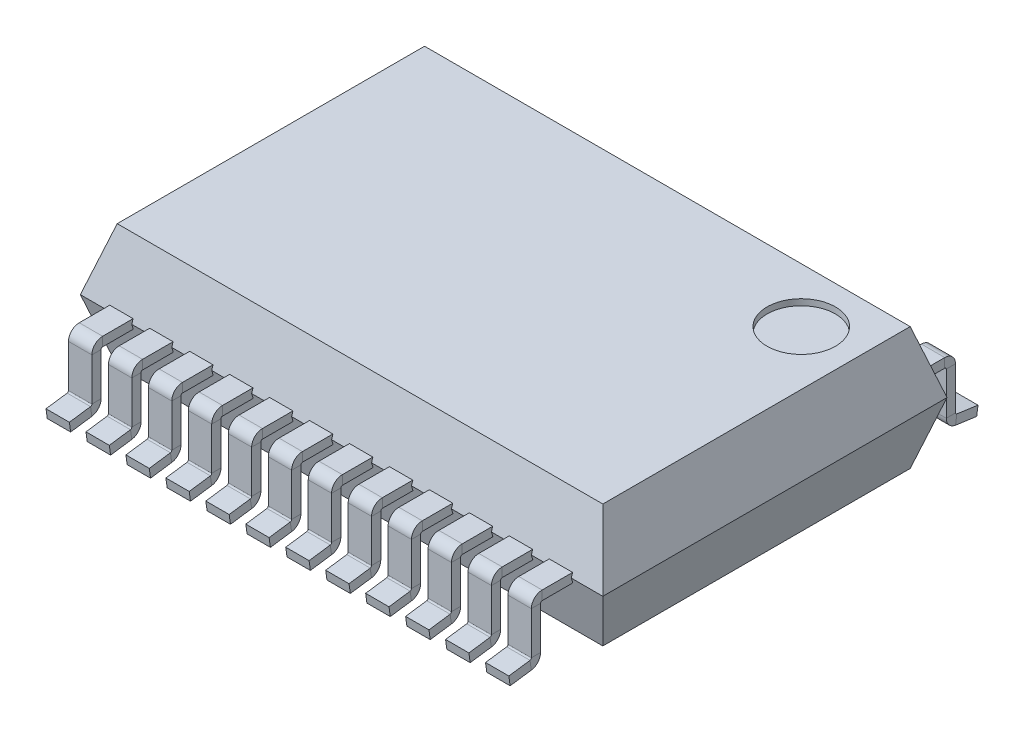
from build123d import *

# Parameters (mm, degrees)
BOSS_EXTRUDE1_DEPTH      = 1
BOSS_EXTRUDE1_DEPTH_BACK = 1
SKETCH1_W                = 8.5
SKETCH1_H                = 5.6
CHAMFER2_SIZE            = 0.3
CHAMFER2_SIZE2           = 1
CHAMFER5_SIZE            = 1
CHAMFER5_SIZE_2          = 0.3
BASE_FLANGE3_DEPTH       = 0.38
DERIVEDBEND140_START     = -3.7925
DERIVEDBEND140_DEPTH     = 0.38
DERIVEDBEND140_START_2   = -3.1425
DERIVEDBEND140_2_DEPTH   = 0.38
DERIVEDBEND140_START_3   = -2.4925
DERIVEDBEND140_3_DEPTH   = 0.38
DERIVEDBEND140_START_4   = -1.8425
DERIVEDBEND140_4_DEPTH   = 0.38
DERIVEDBEND140_START_5   = -1.1925
DERIVEDBEND140_5_DEPTH   = 0.38
DERIVEDBEND140_START_6   = 0.1075
DERIVEDBEND140_6_DEPTH   = 0.38
DERIVEDBEND140_START_7   = 0.7575
DERIVEDBEND140_7_DEPTH   = 0.38
DERIVEDBEND140_START_8   = 1.4075
DERIVEDBEND140_8_DEPTH   = 0.38
DERIVEDBEND140_START_9   = 2.0575
DERIVEDBEND140_9_DEPTH   = 0.38
DERIVEDBEND140_START_10  = 2.7075
DERIVEDBEND140_10_DEPTH  = 0.38
DERIVEDBEND140_START_11  = 3.3575
DERIVEDBEND140_11_DEPTH  = 0.38
SKETCH104_R              = 0.555763408
CUT_EXTRUDE2_DEPTH       = 0.1


# Read off the part's stored shape, not the designer's step: DerivedBend140
# Sheet-metal steps are written as plain solids
with BuildPart() as part:
    # Sketch1 → Boss-Extrude1 (new, two sides: drawn at the far end of the back side and taken through both)
    with BuildSketch(Plane(origin=(0, 0, 0), x_dir=(1, 0, 0), z_dir=(0, 1, 0)).offset(-BOSS_EXTRUDE1_DEPTH_BACK)):
        Rectangle(SKETCH1_W, SKETCH1_H)
    extrude(amount=BOSS_EXTRUDE1_DEPTH + BOSS_EXTRUDE1_DEPTH_BACK)

    # Chamfer2
    chamfer2_edges = [part.edges().sort_by_distance(p)[0] for p in [
        (-4.25, -1, 0),
        (0, -1, 2.8),
        (4.25, -1, 0),
        (0, -1, -2.8),
    ]]
    chamfer2_side = [part.faces().sort_by_distance(p)[0] for p in [
        (0, -1, 0),
    ]]
    chamfer(chamfer2_edges, length=CHAMFER2_SIZE, length2=CHAMFER2_SIZE2, reference=chamfer2_side[0])

    # Chamfer5
    # the kernel refuses this chamfer: 1, 0.3 mm, written as the material it takes off along each edge
    with BuildSketch(Plane(origin=(-6.845941668, 1, 2.8), x_dir=(0, -0.9999387354199845, 0.0110691195079924), z_dir=(1, 0, 0))) as chamfer5_piece_1:
        Polygon((CHAMFER5_SIZE * 0.99993873542, CHAMFER5_SIZE * 0.011069119508), (-CHAMFER5_SIZE_2 * 0.011069119508, CHAMFER5_SIZE_2 * 0.99993873542), (0, 0), align=None)
    extrude(amount=13.691883336, mode=Mode.SUBTRACT)
    with BuildSketch(Plane(origin=(-4.25, 1, -5.395941668), x_dir=(-0.0110691195079924, -0.9999387354199845, 0), z_dir=(0, 0, 1))) as chamfer5_piece_2:
        Polygon((CHAMFER5_SIZE * 0.99993873542, CHAMFER5_SIZE * 0.011069119508), (-CHAMFER5_SIZE_2 * 0.011069119508, CHAMFER5_SIZE_2 * 0.99993873542), (0, 0), align=None)
    extrude(amount=10.791883336, mode=Mode.SUBTRACT)
    with BuildSketch(Plane(origin=(6.845941668, 1, -2.8), x_dir=(0, 0.1220777947558593, 0.992520534814039), z_dir=(-1, 0, 0))) as chamfer5_piece_3:
        Polygon((CHAMFER5_SIZE_2 * 0.992520534814, -CHAMFER5_SIZE_2 * 0.122077794756), (-CHAMFER5_SIZE * 0.122077794756, -CHAMFER5_SIZE * 0.992520534814), (0, 0), align=None)
    extrude(amount=13.691883336, mode=Mode.SUBTRACT)
    with BuildSketch(Plane(origin=(4.25, 1, 5.395941668), x_dir=(-0.992520534814039, 0.1220777947558593, 0), z_dir=(0, 0, -1))) as chamfer5_piece_4:
        Polygon((CHAMFER5_SIZE_2 * 0.992520534814, -CHAMFER5_SIZE_2 * 0.122077794756), (-CHAMFER5_SIZE * 0.122077794756, -CHAMFER5_SIZE * 0.992520534814), (0, 0), align=None)
    extrude(amount=10.791883336, mode=Mode.SUBTRACT)

    # Sketch104 → Cut-Extrude2 (cut)
    with BuildSketch(Plane(origin=(0, 1, 0), x_dir=(1, 0, 0), z_dir=(0, 1, 0))):
        with Locations(Location((3.0642029, 1.6142029, 0), (0, 0, 270))):
            Circle(SKETCH104_R)
    extrude(amount=-CUT_EXTRUDE2_DEPTH, mode=Mode.SUBTRACT)


with BuildPart() as body_2:
    # Sketch6 → Base-Flange3 (new body)
    with BuildSketch(Plane(origin=(-0.1625, 0, 0), x_dir=(0, 0, -1), z_dir=(1, 0, 0))):
        with BuildLine():
            Line((-2.771, -0.08), (-3.275, -0.08))
            ThreePointArc((-3.275, -0.08), (-3.29267767, -0.08732233), (-3.3, -0.105))
            Line((-3.3, -0.105), (-3.3, -0.797874821))
            ThreePointArc((-3.3, -0.797874821), (-3.342925823, -0.912685151), (-3.450644707, -0.971171733))
            Line((-3.450644707, -0.971171733), (-3.795134034, -1.01958655))
            Line((-3.795134034, -1.01958655), (-3.81601, -0.87104634))
            Line((-3.81601, -0.87104634), (-3.471520672, -0.822631523))
            ThreePointArc((-3.471520672, -0.822631523), (-3.45613226, -0.814276297), (-3.45, -0.797874821))
            Line((-3.45, -0.797874821), (-3.45, -0.105))
            ThreePointArc((-3.45, -0.105), (-3.398743687, 0.018743687), (-3.275, 0.07))
            Line((-3.275, 0.07), (-2.771, 0.07))
            Line((-2.771, 0.07), (-2.771, -0.08))
        make_face()
    extrude(amount=-BASE_FLANGE3_DEPTH)


with BuildPart() as body_3:
    # DerivedBend140 outline → DerivedBend140 (new body)
    with BuildSketch(Plane.YZ.offset(DERIVEDBEND140_START)):
        with BuildLine():
            ThreePointArc((-0.797874821, 3.45), (-0.814276297, 3.45613226), (-0.822631523, 3.471520672))
            Line((-0.822631523, 3.471520672), (-0.87104634, 3.81601))
            Line((-0.87104634, 3.81601), (-1.01958655, 3.795134034))
            Line((-1.01958655, 3.795134034), (-0.971171733, 3.450644707))
            ThreePointArc((-0.971171733, 3.450644707), (-0.912685151, 3.342925823), (-0.797874821, 3.3))
            Line((-0.797874821, 3.3), (-0.105, 3.3))
            ThreePointArc((-0.105, 3.3), (-0.08732233, 3.29267767), (-0.08, 3.275))
            Line((-0.08, 3.275), (-0.08, 2.771))
            Line((-0.08, 2.771), (0.07, 2.771))
            Line((0.07, 2.771), (0.07, 3.275))
            ThreePointArc((0.07, 3.275), (0.018743687, 3.398743687), (-0.105, 3.45))
            Line((-0.105, 3.45), (-0.797874821, 3.45))
        make_face()
    extrude(amount=DERIVEDBEND140_DEPTH)


with BuildPart() as body_4:
    # DerivedBend140 2 outline → DerivedBend140 2 (new body)
    with BuildSketch(Plane.YZ.offset(DERIVEDBEND140_START_2)):
        with BuildLine():
            ThreePointArc((-0.797874821, 3.45), (-0.814276297, 3.45613226), (-0.822631523, 3.471520672))
            Line((-0.822631523, 3.471520672), (-0.87104634, 3.81601))
            Line((-0.87104634, 3.81601), (-1.01958655, 3.795134034))
            Line((-1.01958655, 3.795134034), (-0.971171733, 3.450644707))
            ThreePointArc((-0.971171733, 3.450644707), (-0.912685151, 3.342925823), (-0.797874821, 3.3))
            Line((-0.797874821, 3.3), (-0.105, 3.3))
            ThreePointArc((-0.105, 3.3), (-0.08732233, 3.29267767), (-0.08, 3.275))
            Line((-0.08, 3.275), (-0.08, 2.771))
            Line((-0.08, 2.771), (0.07, 2.771))
            Line((0.07, 2.771), (0.07, 3.275))
            ThreePointArc((0.07, 3.275), (0.018743687, 3.398743687), (-0.105, 3.45))
            Line((-0.105, 3.45), (-0.797874821, 3.45))
        make_face()
    extrude(amount=DERIVEDBEND140_2_DEPTH)


with BuildPart() as body_5:
    # DerivedBend140 3 outline → DerivedBend140 3 (new body)
    with BuildSketch(Plane.YZ.offset(DERIVEDBEND140_START_3)):
        with BuildLine():
            ThreePointArc((-0.797874821, 3.45), (-0.814276297, 3.45613226), (-0.822631523, 3.471520672))
            Line((-0.822631523, 3.471520672), (-0.87104634, 3.81601))
            Line((-0.87104634, 3.81601), (-1.01958655, 3.795134034))
            Line((-1.01958655, 3.795134034), (-0.971171733, 3.450644707))
            ThreePointArc((-0.971171733, 3.450644707), (-0.912685151, 3.342925823), (-0.797874821, 3.3))
            Line((-0.797874821, 3.3), (-0.105, 3.3))
            ThreePointArc((-0.105, 3.3), (-0.08732233, 3.29267767), (-0.08, 3.275))
            Line((-0.08, 3.275), (-0.08, 2.771))
            Line((-0.08, 2.771), (0.07, 2.771))
            Line((0.07, 2.771), (0.07, 3.275))
            ThreePointArc((0.07, 3.275), (0.018743687, 3.398743687), (-0.105, 3.45))
            Line((-0.105, 3.45), (-0.797874821, 3.45))
        make_face()
    extrude(amount=DERIVEDBEND140_3_DEPTH)


with BuildPart() as body_6:
    # DerivedBend140 4 outline → DerivedBend140 4 (new body)
    with BuildSketch(Plane.YZ.offset(DERIVEDBEND140_START_4)):
        with BuildLine():
            ThreePointArc((-0.797874821, 3.45), (-0.814276297, 3.45613226), (-0.822631523, 3.471520672))
            Line((-0.822631523, 3.471520672), (-0.87104634, 3.81601))
            Line((-0.87104634, 3.81601), (-1.01958655, 3.795134034))
            Line((-1.01958655, 3.795134034), (-0.971171733, 3.450644707))
            ThreePointArc((-0.971171733, 3.450644707), (-0.912685151, 3.342925823), (-0.797874821, 3.3))
            Line((-0.797874821, 3.3), (-0.105, 3.3))
            ThreePointArc((-0.105, 3.3), (-0.08732233, 3.29267767), (-0.08, 3.275))
            Line((-0.08, 3.275), (-0.08, 2.771))
            Line((-0.08, 2.771), (0.07, 2.771))
            Line((0.07, 2.771), (0.07, 3.275))
            ThreePointArc((0.07, 3.275), (0.018743687, 3.398743687), (-0.105, 3.45))
            Line((-0.105, 3.45), (-0.797874821, 3.45))
        make_face()
    extrude(amount=DERIVEDBEND140_4_DEPTH)


with BuildPart() as body_7:
    # DerivedBend140 5 outline → DerivedBend140 5 (new body)
    with BuildSketch(Plane.YZ.offset(DERIVEDBEND140_START_5)):
        with BuildLine():
            ThreePointArc((-0.797874821, 3.45), (-0.814276297, 3.45613226), (-0.822631523, 3.471520672))
            Line((-0.822631523, 3.471520672), (-0.87104634, 3.81601))
            Line((-0.87104634, 3.81601), (-1.01958655, 3.795134034))
            Line((-1.01958655, 3.795134034), (-0.971171733, 3.450644707))
            ThreePointArc((-0.971171733, 3.450644707), (-0.912685151, 3.342925823), (-0.797874821, 3.3))
            Line((-0.797874821, 3.3), (-0.105, 3.3))
            ThreePointArc((-0.105, 3.3), (-0.08732233, 3.29267767), (-0.08, 3.275))
            Line((-0.08, 3.275), (-0.08, 2.771))
            Line((-0.08, 2.771), (0.07, 2.771))
            Line((0.07, 2.771), (0.07, 3.275))
            ThreePointArc((0.07, 3.275), (0.018743687, 3.398743687), (-0.105, 3.45))
            Line((-0.105, 3.45), (-0.797874821, 3.45))
        make_face()
    extrude(amount=DERIVEDBEND140_5_DEPTH)


with BuildPart() as body_8:
    # DerivedBend140 6 outline → DerivedBend140 6 (new body)
    with BuildSketch(Plane.YZ.offset(DERIVEDBEND140_START_6)):
        with BuildLine():
            ThreePointArc((-0.797874821, 3.45), (-0.814276297, 3.45613226), (-0.822631523, 3.471520672))
            Line((-0.822631523, 3.471520672), (-0.87104634, 3.81601))
            Line((-0.87104634, 3.81601), (-1.01958655, 3.795134034))
            Line((-1.01958655, 3.795134034), (-0.971171733, 3.450644707))
            ThreePointArc((-0.971171733, 3.450644707), (-0.912685151, 3.342925823), (-0.797874821, 3.3))
            Line((-0.797874821, 3.3), (-0.105, 3.3))
            ThreePointArc((-0.105, 3.3), (-0.08732233, 3.29267767), (-0.08, 3.275))
            Line((-0.08, 3.275), (-0.08, 2.771))
            Line((-0.08, 2.771), (0.07, 2.771))
            Line((0.07, 2.771), (0.07, 3.275))
            ThreePointArc((0.07, 3.275), (0.018743687, 3.398743687), (-0.105, 3.45))
            Line((-0.105, 3.45), (-0.797874821, 3.45))
        make_face()
    extrude(amount=DERIVEDBEND140_6_DEPTH)


with BuildPart() as body_9:
    # DerivedBend140 7 outline → DerivedBend140 7 (new body)
    with BuildSketch(Plane.YZ.offset(DERIVEDBEND140_START_7)):
        with BuildLine():
            ThreePointArc((-0.797874821, 3.45), (-0.814276297, 3.45613226), (-0.822631523, 3.471520672))
            Line((-0.822631523, 3.471520672), (-0.87104634, 3.81601))
            Line((-0.87104634, 3.81601), (-1.01958655, 3.795134034))
            Line((-1.01958655, 3.795134034), (-0.971171733, 3.450644707))
            ThreePointArc((-0.971171733, 3.450644707), (-0.912685151, 3.342925823), (-0.797874821, 3.3))
            Line((-0.797874821, 3.3), (-0.105, 3.3))
            ThreePointArc((-0.105, 3.3), (-0.08732233, 3.29267767), (-0.08, 3.275))
            Line((-0.08, 3.275), (-0.08, 2.771))
            Line((-0.08, 2.771), (0.07, 2.771))
            Line((0.07, 2.771), (0.07, 3.275))
            ThreePointArc((0.07, 3.275), (0.018743687, 3.398743687), (-0.105, 3.45))
            Line((-0.105, 3.45), (-0.797874821, 3.45))
        make_face()
    extrude(amount=DERIVEDBEND140_7_DEPTH)


with BuildPart() as body_10:
    # DerivedBend140 8 outline → DerivedBend140 8 (new body)
    with BuildSketch(Plane.YZ.offset(DERIVEDBEND140_START_8)):
        with BuildLine():
            ThreePointArc((-0.797874821, 3.45), (-0.814276297, 3.45613226), (-0.822631523, 3.471520672))
            Line((-0.822631523, 3.471520672), (-0.87104634, 3.81601))
            Line((-0.87104634, 3.81601), (-1.01958655, 3.795134034))
            Line((-1.01958655, 3.795134034), (-0.971171733, 3.450644707))
            ThreePointArc((-0.971171733, 3.450644707), (-0.912685151, 3.342925823), (-0.797874821, 3.3))
            Line((-0.797874821, 3.3), (-0.105, 3.3))
            ThreePointArc((-0.105, 3.3), (-0.08732233, 3.29267767), (-0.08, 3.275))
            Line((-0.08, 3.275), (-0.08, 2.771))
            Line((-0.08, 2.771), (0.07, 2.771))
            Line((0.07, 2.771), (0.07, 3.275))
            ThreePointArc((0.07, 3.275), (0.018743687, 3.398743687), (-0.105, 3.45))
            Line((-0.105, 3.45), (-0.797874821, 3.45))
        make_face()
    extrude(amount=DERIVEDBEND140_8_DEPTH)


with BuildPart() as body_11:
    # DerivedBend140 9 outline → DerivedBend140 9 (new body)
    with BuildSketch(Plane.YZ.offset(DERIVEDBEND140_START_9)):
        with BuildLine():
            ThreePointArc((-0.797874821, 3.45), (-0.814276297, 3.45613226), (-0.822631523, 3.471520672))
            Line((-0.822631523, 3.471520672), (-0.87104634, 3.81601))
            Line((-0.87104634, 3.81601), (-1.01958655, 3.795134034))
            Line((-1.01958655, 3.795134034), (-0.971171733, 3.450644707))
            ThreePointArc((-0.971171733, 3.450644707), (-0.912685151, 3.342925823), (-0.797874821, 3.3))
            Line((-0.797874821, 3.3), (-0.105, 3.3))
            ThreePointArc((-0.105, 3.3), (-0.08732233, 3.29267767), (-0.08, 3.275))
            Line((-0.08, 3.275), (-0.08, 2.771))
            Line((-0.08, 2.771), (0.07, 2.771))
            Line((0.07, 2.771), (0.07, 3.275))
            ThreePointArc((0.07, 3.275), (0.018743687, 3.398743687), (-0.105, 3.45))
            Line((-0.105, 3.45), (-0.797874821, 3.45))
        make_face()
    extrude(amount=DERIVEDBEND140_9_DEPTH)


with BuildPart() as body_12:
    # DerivedBend140 10 outline → DerivedBend140 10 (new body)
    with BuildSketch(Plane.YZ.offset(DERIVEDBEND140_START_10)):
        with BuildLine():
            ThreePointArc((-0.797874821, 3.45), (-0.814276297, 3.45613226), (-0.822631523, 3.471520672))
            Line((-0.822631523, 3.471520672), (-0.87104634, 3.81601))
            Line((-0.87104634, 3.81601), (-1.01958655, 3.795134034))
            Line((-1.01958655, 3.795134034), (-0.971171733, 3.450644707))
            ThreePointArc((-0.971171733, 3.450644707), (-0.912685151, 3.342925823), (-0.797874821, 3.3))
            Line((-0.797874821, 3.3), (-0.105, 3.3))
            ThreePointArc((-0.105, 3.3), (-0.08732233, 3.29267767), (-0.08, 3.275))
            Line((-0.08, 3.275), (-0.08, 2.771))
            Line((-0.08, 2.771), (0.07, 2.771))
            Line((0.07, 2.771), (0.07, 3.275))
            ThreePointArc((0.07, 3.275), (0.018743687, 3.398743687), (-0.105, 3.45))
            Line((-0.105, 3.45), (-0.797874821, 3.45))
        make_face()
    extrude(amount=DERIVEDBEND140_10_DEPTH)


with BuildPart() as body_13:
    # DerivedBend140 11 outline → DerivedBend140 11 (new body)
    with BuildSketch(Plane.YZ.offset(DERIVEDBEND140_START_11)):
        with BuildLine():
            ThreePointArc((-0.797874821, 3.45), (-0.814276297, 3.45613226), (-0.822631523, 3.471520672))
            Line((-0.822631523, 3.471520672), (-0.87104634, 3.81601))
            Line((-0.87104634, 3.81601), (-1.01958655, 3.795134034))
            Line((-1.01958655, 3.795134034), (-0.971171733, 3.450644707))
            ThreePointArc((-0.971171733, 3.450644707), (-0.912685151, 3.342925823), (-0.797874821, 3.3))
            Line((-0.797874821, 3.3), (-0.105, 3.3))
            ThreePointArc((-0.105, 3.3), (-0.08732233, 3.29267767), (-0.08, 3.275))
            Line((-0.08, 3.275), (-0.08, 2.771))
            Line((-0.08, 2.771), (0.07, 2.771))
            Line((0.07, 2.771), (0.07, 3.275))
            ThreePointArc((0.07, 3.275), (0.018743687, 3.398743687), (-0.105, 3.45))
            Line((-0.105, 3.45), (-0.797874821, 3.45))
        make_face()
    extrude(amount=DERIVEDBEND140_11_DEPTH)


with BuildPart() as body_14:
    # Mirror1: mirrored copy
    add(body_13.part.mirror(Plane(origin=(0, 0, 0), x_dir=(1, 0, 0), z_dir=(0, 0, -1))))


with BuildPart() as body_15:
    # Mirror1 2: mirrored copy
    add(body_12.part.mirror(Plane(origin=(0, 0, 0), x_dir=(1, 0, 0), z_dir=(0, 0, -1))))


with BuildPart() as body_16:
    # Mirror1 3: mirrored copy
    add(body_11.part.mirror(Plane(origin=(0, 0, 0), x_dir=(1, 0, 0), z_dir=(0, 0, -1))))


with BuildPart() as body_17:
    # Mirror1 4: mirrored copy
    add(body_10.part.mirror(Plane(origin=(0, 0, 0), x_dir=(1, 0, 0), z_dir=(0, 0, -1))))


with BuildPart() as body_18:
    # Mirror1 5: mirrored copy
    add(body_9.part.mirror(Plane(origin=(0, 0, 0), x_dir=(1, 0, 0), z_dir=(0, 0, -1))))


with BuildPart() as body_19:
    # Mirror1 6: mirrored copy
    add(body_8.part.mirror(Plane(origin=(0, 0, 0), x_dir=(1, 0, 0), z_dir=(0, 0, -1))))


with BuildPart() as body_20:
    # Mirror1 7: mirrored copy
    add(body_2.part.mirror(Plane(origin=(0, 0, 0), x_dir=(1, 0, 0), z_dir=(0, 0, -1))))


with BuildPart() as body_21:
    # Mirror1 8: mirrored copy
    add(body_7.part.mirror(Plane(origin=(0, 0, 0), x_dir=(1, 0, 0), z_dir=(0, 0, -1))))


with BuildPart() as body_22:
    # Mirror1 9: mirrored copy
    add(body_6.part.mirror(Plane(origin=(0, 0, 0), x_dir=(1, 0, 0), z_dir=(0, 0, -1))))


with BuildPart() as body_23:
    # Mirror1 10: mirrored copy
    add(body_5.part.mirror(Plane(origin=(0, 0, 0), x_dir=(1, 0, 0), z_dir=(0, 0, -1))))


with BuildPart() as body_24:
    # Mirror1 11: mirrored copy
    add(body_4.part.mirror(Plane(origin=(0, 0, 0), x_dir=(1, 0, 0), z_dir=(0, 0, -1))))


with BuildPart() as body_25:
    # Mirror1 12: mirrored copy
    add(body_3.part.mirror(Plane(origin=(0, 0, 0), x_dir=(1, 0, 0), z_dir=(0, 0, -1))))


solid = Compound([part.part, body_2.part, body_3.part, body_4.part, body_5.part, body_6.part, body_7.part, body_8.part, body_9.part, body_10.part, body_11.part, body_12.part, body_13.part, body_14.part, body_15.part, body_16.part, body_17.part, body_18.part, body_19.part, body_20.part, body_21.part, body_22.part, body_23.part, body_24.part, body_25.part])
